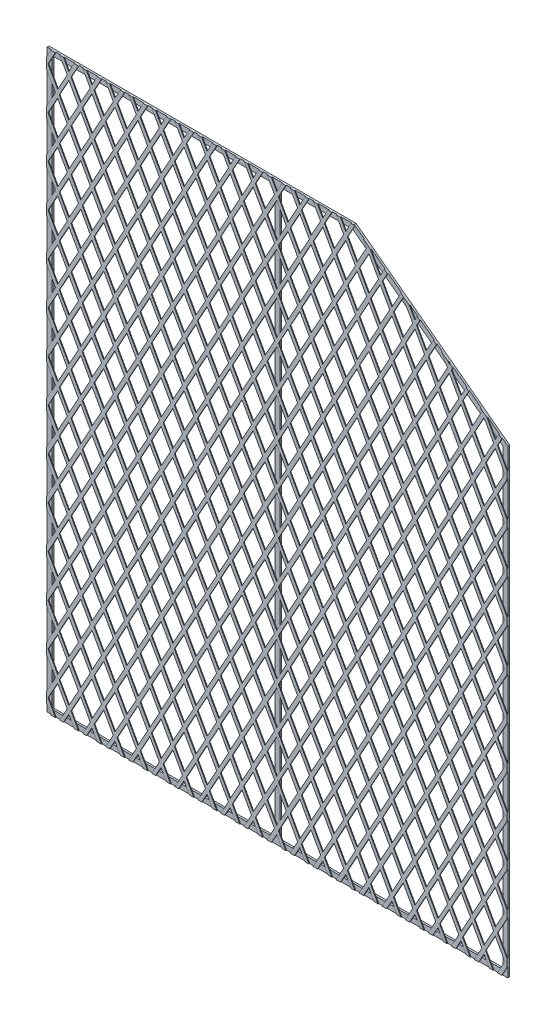
from build123d import *

# Parameters (mm, degrees)
CROQUIS1_W              = 580.95
CROQUIS1_H              = 1474.6
SALIENTE_EXTRUIR1_DEPTH = 4.8
SALIENTE_EXTRUIR2_DEPTH = 1.9
CORTAR_EXTRUIR1_DEPTH   = 1.9
MATRIZL1_COUNT          = 8
MATRIZL1_PITCH          = 110
MATRIZL2_COUNT          = 8
MATRIZL2_PITCH          = 110


with BuildPart() as part:
    # Croquis1 → Saliente-Extruir1 (new body)
    with BuildSketch(Plane.XY):
        Polygon((0, 0), (0, 1500), (800, 1500), (1200, 1200), (1200, 0), align=None)
        with Locations((303.175, 750)):
            Rectangle(CROQUIS1_W, CROQUIS1_H, mode=Mode.SUBTRACT)
        Polygon((795.766666667, 1487.3), (1187.3, 1193.65), (1187.3, 12.7), (606.35, 12.7), (606.35, 1487.3), align=None, mode=Mode.SUBTRACT)
    extrude(amount=SALIENTE_EXTRUIR1_DEPTH)

    # Croquis2 → Saliente-Extruir2 (add)
    with BuildSketch(Plane.XY.offset(4.8)):
        Polygon((0, 1500), (800, 1500), (1200, 1200), (1200, 0), (0, 0), align=None)
    extrude(amount=SALIENTE_EXTRUIR2_DEPTH)

    # Croquis3 → Cortar-Extruir1 (cut)
    with BuildSketch(Plane.XY.offset(6.7)):
        Polygon((600, 795), (625, 750), (600, 705), (575, 750), align=None)
        Polygon((538.560410954, 795), (563.560410954, 750), (538.560410954, 705), (513.560410954, 750), align=None)
        Polygon((569.280205477, 850.295630141), (594.280205477, 805.295630141), (569.280205477, 760.295630141), (544.280205477, 805.295630141), align=None)
        Polygon((503.560410954, 750), (478.560410954, 705), (453.560410954, 750), (478.560410954, 795), align=None)
        Polygon((484.280205477, 805.295630141), (509.280205477, 850.295630141), (534.280205477, 805.295630141), (509.280205477, 760.295630141), align=None)
        Polygon((443.560410954, 750), (418.560410954, 705), (393.560410954, 750), (418.560410954, 795), align=None)
        Polygon((424.280205477, 805.295630141), (449.280205477, 850.295630141), (474.280205477, 805.295630141), (449.280205477, 760.295630141), align=None)
        Polygon((383.560410954, 750), (358.560410954, 705), (333.560410954, 750), (358.560410954, 795), align=None)
        Polygon((364.280205477, 805.295630141), (389.280205477, 850.295630141), (414.280205477, 805.295630141), (389.280205477, 760.295630141), align=None)
        Polygon((323.560410954, 750), (298.560410954, 705), (273.560410954, 750), (298.560410954, 795), align=None)
        Polygon((304.280205477, 805.295630141), (329.280205477, 850.295630141), (354.280205477, 805.295630141), (329.280205477, 760.295630141), align=None)
        Polygon((263.560410954, 750), (238.560410954, 705), (213.560410954, 750), (238.560410954, 795), align=None)
        Polygon((244.280205477, 805.295630141), (269.280205477, 850.295630141), (294.280205477, 805.295630141), (269.280205477, 760.295630141), align=None)
        Polygon((203.560410954, 750), (178.560410954, 705), (153.560410954, 750), (178.560410954, 795), align=None)
        Polygon((184.280205477, 805.295630141), (209.280205477, 850.295630141), (234.280205477, 805.295630141), (209.280205477, 760.295630141), align=None)
        Polygon((143.560410954, 750), (118.560410954, 705), (93.560410954, 750), (118.560410954, 795), align=None)
        Polygon((124.280205477, 805.295630141), (149.280205477, 850.295630141), (174.280205477, 805.295630141), (149.280205477, 760.295630141), align=None)
        Polygon((83.560410954, 750), (58.560410954, 705), (33.560410954, 750), (58.560410954, 795), align=None)
        Polygon((64.280205477, 805.295630141), (89.280205477, 850.295630141), (114.280205477, 805.295630141), (89.280205477, 760.295630141), align=None)
        Polygon((23.560410954, 750), (-1.439589046, 705), (-26.439589046, 750), (-1.439589046, 795), align=None)
        Polygon((4.280205477, 805.295630141), (29.280205477, 850.295630141), (54.280205477, 805.295630141), (29.280205477, 760.295630141), align=None)
        Polygon((629.280205477, 760.295630141), (604.280205477, 805.295630141), (629.280205477, 850.295630141), (654.280205477, 805.295630141), align=None)
        Polygon((660, 705), (635, 750), (660, 795), (685, 750), align=None)
        Polygon((689.280205477, 760.295630141), (664.280205477, 805.295630141), (689.280205477, 850.295630141), (714.280205477, 805.295630141), align=None)
        Polygon((720, 705), (695, 750), (720, 795), (745, 750), align=None)
        Polygon((749.280205477, 760.295630141), (724.280205477, 805.295630141), (749.280205477, 850.295630141), (774.280205477, 805.295630141), align=None)
        Polygon((780, 705), (755, 750), (780, 795), (805, 750), align=None)
        Polygon((809.280205477, 760.295630141), (784.280205477, 805.295630141), (809.280205477, 850.295630141), (834.280205477, 805.295630141), align=None)
        Polygon((840, 705), (815, 750), (840, 795), (865, 750), align=None)
        Polygon((869.280205477, 760.295630141), (844.280205477, 805.295630141), (869.280205477, 850.295630141), (894.280205477, 805.295630141), align=None)
        Polygon((900, 705), (875, 750), (900, 795), (925, 750), align=None)
        Polygon((929.280205477, 760.295630141), (904.280205477, 805.295630141), (929.280205477, 850.295630141), (954.280205477, 805.295630141), align=None)
        Polygon((960, 705), (935, 750), (960, 795), (985, 750), align=None)
        Polygon((989.280205477, 760.295630141), (964.280205477, 805.295630141), (989.280205477, 850.295630141), (1014.280205477, 805.295630141), align=None)
        Polygon((1020, 705), (995, 750), (1020, 795), (1045, 750), align=None)
        Polygon((1049.280205477, 760.295630141), (1024.280205477, 805.295630141), (1049.280205477, 850.295630141), (1074.280205477, 805.295630141), align=None)
        Polygon((1080, 705), (1055, 750), (1080, 795), (1105, 750), align=None)
        Polygon((1109.280205477, 760.295630141), (1084.280205477, 805.295630141), (1109.280205477, 850.295630141), (1134.280205477, 805.295630141), align=None)
        Polygon((1140, 705), (1115, 750), (1140, 795), (1165, 750), align=None)
        Polygon((1169.280205477, 760.295630141), (1144.280205477, 805.295630141), (1169.280205477, 850.295630141), (1194.280205477, 805.295630141), align=None)
        Polygon((1200, 705), (1175, 750), (1200, 795), (1225, 750), align=None)
    cortar_extruir1 = extrude(amount=-CORTAR_EXTRUIR1_DEPTH, mode=Mode.SUBTRACT)

    # MatrizL1: Cortar-Extruir1 ×8
    with Locations(*[(0, -i * MATRIZL1_PITCH, 0) for i in range(1, MATRIZL1_COUNT)]):
        add(cortar_extruir1, mode=Mode.SUBTRACT)

    # MatrizL2: Cortar-Extruir1 ×8
    with Locations(*[(0, i * MATRIZL2_PITCH, 0) for i in range(1, MATRIZL2_COUNT)]):
        add(cortar_extruir1, mode=Mode.SUBTRACT)


solid = part.part
